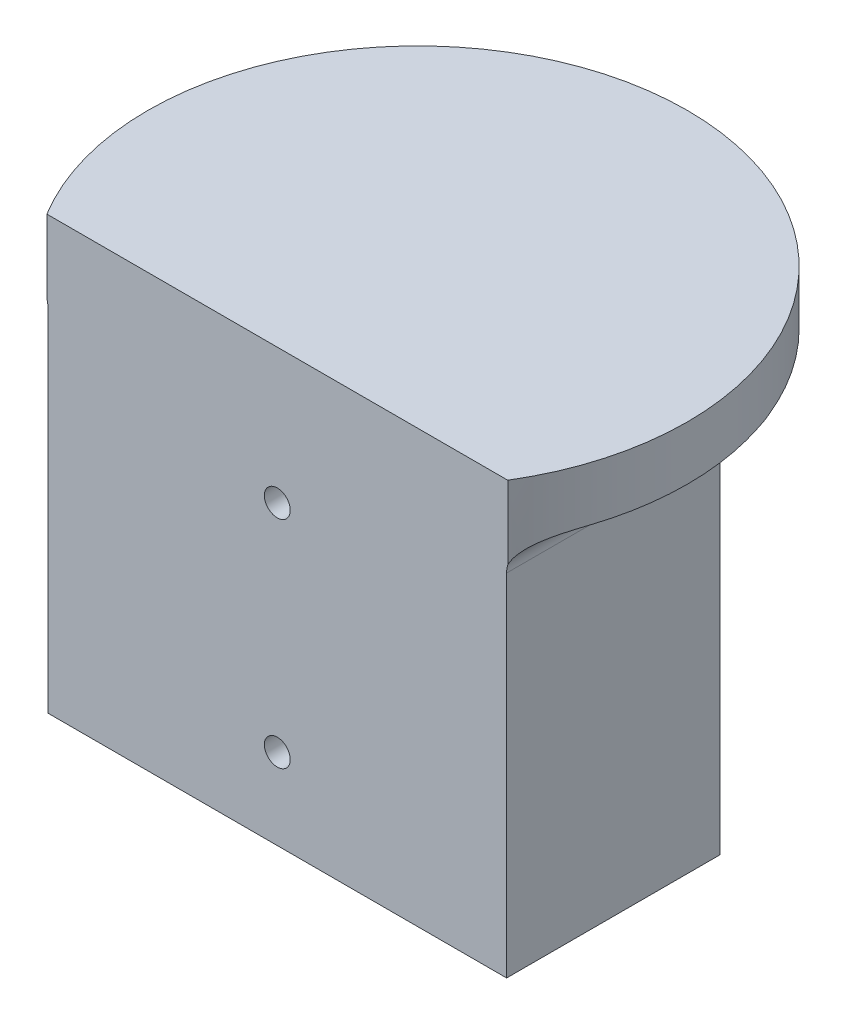
from build123d import *

# Parameters (mm, degrees)
SKETCH1_W                      = 10
SKETCH1_H                      = 29.5
SKETCH1_R                      = 2.75
BOSS_EXTRUDE1_DEPTH            = 10
BOSS_EXTRUDE4_DEPTH            = 60
BOSS_EXTRUDE5_DEPTH            = 10
FILLET2_R                      = 5
CBORE_FOR_M4_SHCS2_D           = 4.8
CBORE_FOR_M4_SHCS2_CBORE_D     = 8
CBORE_FOR_M4_SHCS2_CBORE_DEPTH = 4


with BuildPart() as part:
    # Sketch1 → Boss-Extrude1 (new body)
    # profile 1 of 3: a face of its own
    with BuildSketch(Plane(origin=(0, 0, 0), x_dir=(1, 0, 0), z_dir=(0, 1, 0))):
        with Locations((-37.5, -1.25)):
            Rectangle(SKETCH1_W, SKETCH1_H)
        with Locations(Location((-37.5, -8.5, 0), (0, 0, 270))):
            Circle(SKETCH1_R, mode=Mode.SUBTRACT)
        with Locations(Location((-37.5, 8.5, 0), (0, 0, 270))):
            Circle(SKETCH1_R, mode=Mode.SUBTRACT)
    # profile 2 of 3: a face of its own
    with BuildSketch(Plane(origin=(0, 0, 0), x_dir=(1, 0, 0), z_dir=(0, 1, 0))):
        Polygon((-32.5, -16), (-42.5, -16), (-42.5, -26), (42.5, -26), (42.5, -16), (32.5, -16), align=None)
    # profile 3 of 3: a face of its own
    with BuildSketch(Plane(origin=(0, 0, 0), x_dir=(1, 0, 0), z_dir=(0, 1, 0))):
        with Locations((37.5, -1.25)):
            Rectangle(SKETCH1_W, SKETCH1_H)
        with Locations(Location((37.5, -8.5, 0), (0, 0, 270))):
            Circle(SKETCH1_R, mode=Mode.SUBTRACT)
        with Locations(Location((37.5, 8.5, 0), (0, 0, 270))):
            Circle(SKETCH1_R, mode=Mode.SUBTRACT)
    extrude(amount=BOSS_EXTRUDE1_DEPTH)

    # Sketch6 → Boss-Extrude4 (add)
    with BuildSketch(Plane(origin=(0, 10, 0), x_dir=(1, 0, 0), z_dir=(0, 1, 0))):
        Polygon((-32.5, -16), (-32.5, 13.5), (-42.5, 13.5), (-42.5, -26), (42.5, -26), (42.5, 13.5), (32.5, 13.5), (32.5, -16), align=None)
    extrude(amount=BOSS_EXTRUDE4_DEPTH)

    # Sketch7 → Boss-Extrude5 (add)
    with BuildSketch(Plane(origin=(0, 70, 0), x_dir=(1, 0, 0), z_dir=(0, 1, 0))):
        with BuildLine():
            Line((-42.5, -26), (42.5, -26))
            Line((42.5, -26), (42.708313008, -26))
            ThreePointArc((42.708313008, -26), (0, 50), (-42.708313008, -26))
            Line((-42.708313008, -26), (-42.5, -26))
        make_face()
    extrude(amount=BOSS_EXTRUDE5_DEPTH)

    # Fillet2
    # the kernel refuses this fillet: 5 mm, written as the material it adds along each edge
    with BuildSketch(Plane(origin=(42.5, 70, 26), x_dir=(1, 0, 0), z_dir=(0, 0, -1))) as fillet2_piece_1_section:
        with BuildLine():
            CenterArc((FILLET2_R, FILLET2_R), FILLET2_R, 180, 90)
            Line((0, FILLET2_R), (-FILLET2_R * 0.02, FILLET2_R))
            Line((-FILLET2_R * 0.02, FILLET2_R), (-FILLET2_R * 0.02, -FILLET2_R * 0.02))
            Line((-FILLET2_R * 0.02, -FILLET2_R * 0.02), (FILLET2_R, -FILLET2_R * 0.02))
            Line((FILLET2_R, -FILLET2_R * 0.02), (FILLET2_R, 0))
        make_face()
    fillet2_piece_1 = extrude(amount=39.5, mode=Mode.PRIVATE)
    fillet2_piece_1 = fillet2_piece_1 & Plane(origin=(0, 68.835749357, 0), x_dir=(0.8541662601625051, 0, 0.5199999999999999), z_dir=(0, -1, 0)) * Cylinder(50, 100, mode=Mode.PRIVATE)
    add(fillet2_piece_1)
    with BuildSketch(Plane(origin=(42.5, 70, -13.5), x_dir=(0, 0, -1), z_dir=(-1, 0, 0)), Plane(origin=(-32.5, 70, -13.5), x_dir=(0, 0, -1), z_dir=(-1, 0, 0))) as fillet2_piece_2:
        with BuildLine():
            CenterArc((FILLET2_R, FILLET2_R), FILLET2_R, 180, 90)
            Line((0, FILLET2_R), (-FILLET2_R * 0.02, FILLET2_R))
            Line((-FILLET2_R * 0.02, FILLET2_R), (-FILLET2_R * 0.02, -FILLET2_R * 0.02))
            Line((-FILLET2_R * 0.02, -FILLET2_R * 0.02), (FILLET2_R, -FILLET2_R * 0.02))
            Line((FILLET2_R, -FILLET2_R * 0.02), (FILLET2_R, 0))
        make_face()
    extrude(amount=10)
    with BuildSketch(Plane(origin=(32.5, 70, -13.5), x_dir=(-1, 0, 0), z_dir=(0, 0, 1)), Plane(origin=(-32.5, 70, 16), x_dir=(1, 0, 0), z_dir=(0, 0, -1))) as fillet2_piece_3:
        with BuildLine():
            CenterArc((FILLET2_R, FILLET2_R), FILLET2_R, 180, 90)
            Line((0, FILLET2_R), (-FILLET2_R * 0.02, FILLET2_R))
            Line((-FILLET2_R * 0.02, FILLET2_R), (-FILLET2_R * 0.02, -FILLET2_R * 0.02))
            Line((-FILLET2_R * 0.02, -FILLET2_R * 0.02), (FILLET2_R, -FILLET2_R * 0.02))
            Line((FILLET2_R, -FILLET2_R * 0.02), (FILLET2_R, 0))
        make_face()
    extrude(amount=29.5)
    with BuildSketch(Plane(origin=(32.5, 70, 16), x_dir=(0, 0, -1), z_dir=(-1, 0, 0))) as fillet2_piece_4:
        with BuildLine():
            CenterArc((FILLET2_R, FILLET2_R), FILLET2_R, 180, 90)
            Line((0, FILLET2_R), (-FILLET2_R * 0.02, FILLET2_R))
            Line((-FILLET2_R * 0.02, FILLET2_R), (-FILLET2_R * 0.02, -FILLET2_R * 0.02))
            Line((-FILLET2_R * 0.02, -FILLET2_R * 0.02), (FILLET2_R, -FILLET2_R * 0.02))
            Line((FILLET2_R, -FILLET2_R * 0.02), (FILLET2_R, 0))
        make_face()
    extrude(amount=65)
    with BuildSketch(Plane(origin=(-42.5, 70, -13.5), x_dir=(-1, 0, 0), z_dir=(0, 0, 1))) as fillet2_piece_5_section:
        with BuildLine():
            CenterArc((FILLET2_R, FILLET2_R), FILLET2_R, 180, 90)
            Line((0, FILLET2_R), (-FILLET2_R * 0.02, FILLET2_R))
            Line((-FILLET2_R * 0.02, FILLET2_R), (-FILLET2_R * 0.02, -FILLET2_R * 0.02))
            Line((-FILLET2_R * 0.02, -FILLET2_R * 0.02), (FILLET2_R, -FILLET2_R * 0.02))
            Line((FILLET2_R, -FILLET2_R * 0.02), (FILLET2_R, 0))
        make_face()
    fillet2_piece_5 = extrude(amount=39.5, mode=Mode.PRIVATE)
    fillet2_piece_5 = fillet2_piece_5 & Plane(origin=(0, 68.835749403, 0), x_dir=(0.8541662601625051, 0, 0.5199999999999999), z_dir=(0, -1, 0)) * Cylinder(50, 100, mode=Mode.PRIVATE)
    add(fillet2_piece_5)
    with BuildSketch(Plane(origin=(42.5, 70, 26), x_dir=(1, 0, 0), z_dir=(0, 0, -1))) as fillet2_piece_6a_section:
        with BuildLine():
            CenterArc((FILLET2_R, FILLET2_R), FILLET2_R, 180, 90)
            Line((0, FILLET2_R), (-FILLET2_R * 0.02, FILLET2_R))
            Line((-FILLET2_R * 0.02, FILLET2_R), (-FILLET2_R * 0.02, -FILLET2_R * 0.02))
            Line((-FILLET2_R * 0.02, -FILLET2_R * 0.02), (FILLET2_R, -FILLET2_R * 0.02))
            Line((FILLET2_R, -FILLET2_R * 0.02), (FILLET2_R, 0))
        make_face()
    fillet2_piece_6a = extrude(amount=52, mode=Mode.PRIVATE)
    fillet2_piece_6a = fillet2_piece_6a & Plane(origin=(0, 68.754666654, 0), x_dir=(0.8541662601625051, 0, 0.5199999999999999), z_dir=(0, -1, 0)) * Cylinder(50, 125, mode=Mode.PRIVATE)
    fillet2_piece_6a = split(fillet2_piece_6a, bisect_by=Plane(origin=(43.429472086, 68.754666654, -13.5), z_dir=(0, 0, -1)), keep=Keep.TOP, mode=Mode.PRIVATE)
    with BuildSketch(Plane(origin=(55, 70, -13.5), x_dir=(0, 0, -1), z_dir=(-1, 0, 0))) as fillet2_piece_6b_section:
        with BuildLine():
            CenterArc((FILLET2_R, FILLET2_R), FILLET2_R, 180, 90)
            Line((0, FILLET2_R), (-FILLET2_R * 0.02, FILLET2_R))
            Line((-FILLET2_R * 0.02, FILLET2_R), (-FILLET2_R * 0.02, -FILLET2_R * 0.02))
            Line((-FILLET2_R * 0.02, -FILLET2_R * 0.02), (FILLET2_R, -FILLET2_R * 0.02))
            Line((FILLET2_R, -FILLET2_R * 0.02), (FILLET2_R, 0))
        make_face()
    fillet2_piece_6b = extrude(amount=22.5, mode=Mode.PRIVATE)
    fillet2_piece_6b = fillet2_piece_6b & Plane(origin=(0, 68.82733242, 0), x_dir=(0.8541662601625051, 0, 0.5199999999999999), z_dir=(0, -1, 0)) * Cylinder(50, 65, mode=Mode.PRIVATE)
    fillet2_piece_6b = split(fillet2_piece_6b, bisect_by=Plane(origin=(42.5, 68.82733242, -14.561731355), z_dir=(1, 0, 0)), keep=Keep.TOP, mode=Mode.PRIVATE)
    fillet2_piece_6 = fillet2_piece_6a & fillet2_piece_6b
    add(fillet2_piece_6)
    with BuildSketch(Plane(origin=(42.5, 70, -13.5), x_dir=(0, 0, -1), z_dir=(-1, 0, 0))) as fillet2_piece_7a_section:
        with BuildLine():
            CenterArc((FILLET2_R, FILLET2_R), FILLET2_R, 180, 90)
            Line((0, FILLET2_R), (-FILLET2_R * 0.02, FILLET2_R))
            Line((-FILLET2_R * 0.02, FILLET2_R), (-FILLET2_R * 0.02, -FILLET2_R * 0.02))
            Line((-FILLET2_R * 0.02, -FILLET2_R * 0.02), (FILLET2_R, -FILLET2_R * 0.02))
            Line((FILLET2_R, -FILLET2_R * 0.02), (FILLET2_R, 0))
        make_face()
    fillet2_piece_7a = extrude(amount=22.5, mode=Mode.PRIVATE)
    fillet2_piece_7a = split(fillet2_piece_7a, bisect_by=Plane(origin=(32.5, 68.868024429, -14.631975571), z_dir=(-1, 0, 0)), keep=Keep.TOP, mode=Mode.PRIVATE)
    with BuildSketch(Plane(origin=(32.5, 70, -26), x_dir=(-1, 0, 0), z_dir=(0, 0, 1))) as fillet2_piece_7b_section:
        with BuildLine():
            CenterArc((FILLET2_R, FILLET2_R), FILLET2_R, 180, 90)
            Line((0, FILLET2_R), (-FILLET2_R * 0.02, FILLET2_R))
            Line((-FILLET2_R * 0.02, FILLET2_R), (-FILLET2_R * 0.02, -FILLET2_R * 0.02))
            Line((-FILLET2_R * 0.02, -FILLET2_R * 0.02), (FILLET2_R, -FILLET2_R * 0.02))
            Line((FILLET2_R, -FILLET2_R * 0.02), (FILLET2_R, 0))
        make_face()
    fillet2_piece_7b = extrude(amount=42, mode=Mode.PRIVATE)
    fillet2_piece_7b = split(fillet2_piece_7b, bisect_by=Plane(origin=(31.368024429, 68.868024429, -13.5), z_dir=(0, 0, -1)), keep=Keep.TOP, mode=Mode.PRIVATE)
    fillet2_piece_7 = fillet2_piece_7a & fillet2_piece_7b
    add(fillet2_piece_7)
    with BuildSketch(Plane(origin=(32.5, 70, -13.5), x_dir=(-1, 0, 0), z_dir=(0, 0, 1))) as fillet2_piece_8a_section:
        with BuildLine():
            CenterArc((FILLET2_R, FILLET2_R), FILLET2_R, 180, 90)
            Line((0, FILLET2_R), (-FILLET2_R * 0.02, FILLET2_R))
            Line((-FILLET2_R * 0.02, FILLET2_R), (-FILLET2_R * 0.02, -FILLET2_R * 0.02))
            Line((-FILLET2_R * 0.02, -FILLET2_R * 0.02), (FILLET2_R, -FILLET2_R * 0.02))
            Line((FILLET2_R, -FILLET2_R * 0.02), (FILLET2_R, 0))
        make_face()
    fillet2_piece_8a = extrude(amount=42, mode=Mode.PRIVATE)
    fillet2_piece_8a = split(fillet2_piece_8a, bisect_by=Plane(origin=(31.368024429, 68.868024429, 16), z_dir=(0, 0, 1)), keep=Keep.TOP, mode=Mode.PRIVATE)
    with BuildSketch(Plane(origin=(45, 70, 16), x_dir=(0, 0, -1), z_dir=(-1, 0, 0))) as fillet2_piece_8b_section:
        with BuildLine():
            CenterArc((FILLET2_R, FILLET2_R), FILLET2_R, 180, 90)
            Line((0, FILLET2_R), (-FILLET2_R * 0.02, FILLET2_R))
            Line((-FILLET2_R * 0.02, FILLET2_R), (-FILLET2_R * 0.02, -FILLET2_R * 0.02))
            Line((-FILLET2_R * 0.02, -FILLET2_R * 0.02), (FILLET2_R, -FILLET2_R * 0.02))
            Line((FILLET2_R, -FILLET2_R * 0.02), (FILLET2_R, 0))
        make_face()
    fillet2_piece_8b = extrude(amount=77.5, mode=Mode.PRIVATE)
    fillet2_piece_8b = split(fillet2_piece_8b, bisect_by=Plane(origin=(32.5, 68.868024429, 14.868024429), z_dir=(1, 0, 0)), keep=Keep.TOP, mode=Mode.PRIVATE)
    fillet2_piece_8 = fillet2_piece_8a & fillet2_piece_8b
    add(fillet2_piece_8)
    with BuildSketch(Plane(origin=(32.5, 70, 16), x_dir=(0, 0, -1), z_dir=(-1, 0, 0))) as fillet2_piece_9a_section:
        with BuildLine():
            CenterArc((FILLET2_R, FILLET2_R), FILLET2_R, 180, 90)
            Line((0, FILLET2_R), (-FILLET2_R * 0.02, FILLET2_R))
            Line((-FILLET2_R * 0.02, FILLET2_R), (-FILLET2_R * 0.02, -FILLET2_R * 0.02))
            Line((-FILLET2_R * 0.02, -FILLET2_R * 0.02), (FILLET2_R, -FILLET2_R * 0.02))
            Line((FILLET2_R, -FILLET2_R * 0.02), (FILLET2_R, 0))
        make_face()
    fillet2_piece_9a = extrude(amount=77.5, mode=Mode.PRIVATE)
    fillet2_piece_9a = split(fillet2_piece_9a, bisect_by=Plane(origin=(-32.5, 68.868024429, 14.868024429), z_dir=(-1, 0, 0)), keep=Keep.TOP, mode=Mode.PRIVATE)
    with BuildSketch(Plane(origin=(-32.5, 70, 28.5), x_dir=(1, 0, 0), z_dir=(0, 0, -1))) as fillet2_piece_9b_section:
        with BuildLine():
            CenterArc((FILLET2_R, FILLET2_R), FILLET2_R, 180, 90)
            Line((0, FILLET2_R), (-FILLET2_R * 0.02, FILLET2_R))
            Line((-FILLET2_R * 0.02, FILLET2_R), (-FILLET2_R * 0.02, -FILLET2_R * 0.02))
            Line((-FILLET2_R * 0.02, -FILLET2_R * 0.02), (FILLET2_R, -FILLET2_R * 0.02))
            Line((FILLET2_R, -FILLET2_R * 0.02), (FILLET2_R, 0))
        make_face()
    fillet2_piece_9b = extrude(amount=42, mode=Mode.PRIVATE)
    fillet2_piece_9b = split(fillet2_piece_9b, bisect_by=Plane(origin=(-31.368024429, 68.868024429, 16), z_dir=(0, 0, 1)), keep=Keep.TOP, mode=Mode.PRIVATE)
    fillet2_piece_9 = fillet2_piece_9a & fillet2_piece_9b
    add(fillet2_piece_9)
    with BuildSketch(Plane(origin=(-32.5, 70, 16), x_dir=(1, 0, 0), z_dir=(0, 0, -1))) as fillet2_piece_10a_section:
        with BuildLine():
            CenterArc((FILLET2_R, FILLET2_R), FILLET2_R, 180, 90)
            Line((0, FILLET2_R), (-FILLET2_R * 0.02, FILLET2_R))
            Line((-FILLET2_R * 0.02, FILLET2_R), (-FILLET2_R * 0.02, -FILLET2_R * 0.02))
            Line((-FILLET2_R * 0.02, -FILLET2_R * 0.02), (FILLET2_R, -FILLET2_R * 0.02))
            Line((FILLET2_R, -FILLET2_R * 0.02), (FILLET2_R, 0))
        make_face()
    fillet2_piece_10a = extrude(amount=42, mode=Mode.PRIVATE)
    fillet2_piece_10a = split(fillet2_piece_10a, bisect_by=Plane(origin=(-31.368024429, 68.868024429, -13.5), z_dir=(0, 0, -1)), keep=Keep.TOP, mode=Mode.PRIVATE)
    with BuildSketch(Plane(origin=(-20, 70, -13.5), x_dir=(0, 0, -1), z_dir=(-1, 0, 0))) as fillet2_piece_10b_section:
        with BuildLine():
            CenterArc((FILLET2_R, FILLET2_R), FILLET2_R, 180, 90)
            Line((0, FILLET2_R), (-FILLET2_R * 0.02, FILLET2_R))
            Line((-FILLET2_R * 0.02, FILLET2_R), (-FILLET2_R * 0.02, -FILLET2_R * 0.02))
            Line((-FILLET2_R * 0.02, -FILLET2_R * 0.02), (FILLET2_R, -FILLET2_R * 0.02))
            Line((FILLET2_R, -FILLET2_R * 0.02), (FILLET2_R, 0))
        make_face()
    fillet2_piece_10b = extrude(amount=22.5, mode=Mode.PRIVATE)
    fillet2_piece_10b = split(fillet2_piece_10b, bisect_by=Plane(origin=(-32.5, 68.868024429, -14.631975571), z_dir=(1, 0, 0)), keep=Keep.TOP, mode=Mode.PRIVATE)
    fillet2_piece_10 = fillet2_piece_10a & fillet2_piece_10b
    add(fillet2_piece_10)
    with BuildSketch(Plane(origin=(-32.5, 70, -13.5), x_dir=(0, 0, -1), z_dir=(-1, 0, 0))) as fillet2_piece_11a_section:
        with BuildLine():
            CenterArc((FILLET2_R, FILLET2_R), FILLET2_R, 180, 90)
            Line((0, FILLET2_R), (-FILLET2_R * 0.02, FILLET2_R))
            Line((-FILLET2_R * 0.02, FILLET2_R), (-FILLET2_R * 0.02, -FILLET2_R * 0.02))
            Line((-FILLET2_R * 0.02, -FILLET2_R * 0.02), (FILLET2_R, -FILLET2_R * 0.02))
            Line((FILLET2_R, -FILLET2_R * 0.02), (FILLET2_R, 0))
        make_face()
    fillet2_piece_11a = extrude(amount=22.5, mode=Mode.PRIVATE)
    fillet2_piece_11a = fillet2_piece_11a & Plane(origin=(0, 68.827329448, 0), x_dir=(0.8541662601625051, 0, 0.5199999999999999), z_dir=(0, -1, 0)) * Cylinder(50, 65, mode=Mode.PRIVATE)
    fillet2_piece_11a = split(fillet2_piece_11a, bisect_by=Plane(origin=(-42.5, 68.827329448, -14.561744488), z_dir=(-1, 0, 0)), keep=Keep.TOP, mode=Mode.PRIVATE)
    with BuildSketch(Plane(origin=(-42.5, 70, -26), x_dir=(-1, 0, 0), z_dir=(0, 0, 1))) as fillet2_piece_11b_section:
        with BuildLine():
            CenterArc((FILLET2_R, FILLET2_R), FILLET2_R, 180, 90)
            Line((0, FILLET2_R), (-FILLET2_R * 0.02, FILLET2_R))
            Line((-FILLET2_R * 0.02, FILLET2_R), (-FILLET2_R * 0.02, -FILLET2_R * 0.02))
            Line((-FILLET2_R * 0.02, -FILLET2_R * 0.02), (FILLET2_R, -FILLET2_R * 0.02))
            Line((FILLET2_R, -FILLET2_R * 0.02), (FILLET2_R, 0))
        make_face()
    fillet2_piece_11b = extrude(amount=52, mode=Mode.PRIVATE)
    fillet2_piece_11b = fillet2_piece_11b & Plane(origin=(0, 68.754666545, 0), x_dir=(0.8541662601625051, 0, 0.5199999999999999), z_dir=(0, -1, 0)) * Cylinder(50, 125, mode=Mode.PRIVATE)
    fillet2_piece_11b = split(fillet2_piece_11b, bisect_by=Plane(origin=(-43.429471079, 68.754666545, -13.5), z_dir=(0, 0, -1)), keep=Keep.TOP, mode=Mode.PRIVATE)
    fillet2_piece_11 = fillet2_piece_11a & fillet2_piece_11b
    add(fillet2_piece_11)

    # CBORE for M4 SHCS2 (through all)
    with Locations(Plane(origin=(0, 0, 16), x_dir=(-1, 0, 0), z_dir=(0, 0, -1))):
        with Locations((0, 55), (0, 15)):
            CounterBoreHole(CBORE_FOR_M4_SHCS2_D / 2, CBORE_FOR_M4_SHCS2_CBORE_D / 2, CBORE_FOR_M4_SHCS2_CBORE_DEPTH)


solid = part.part
